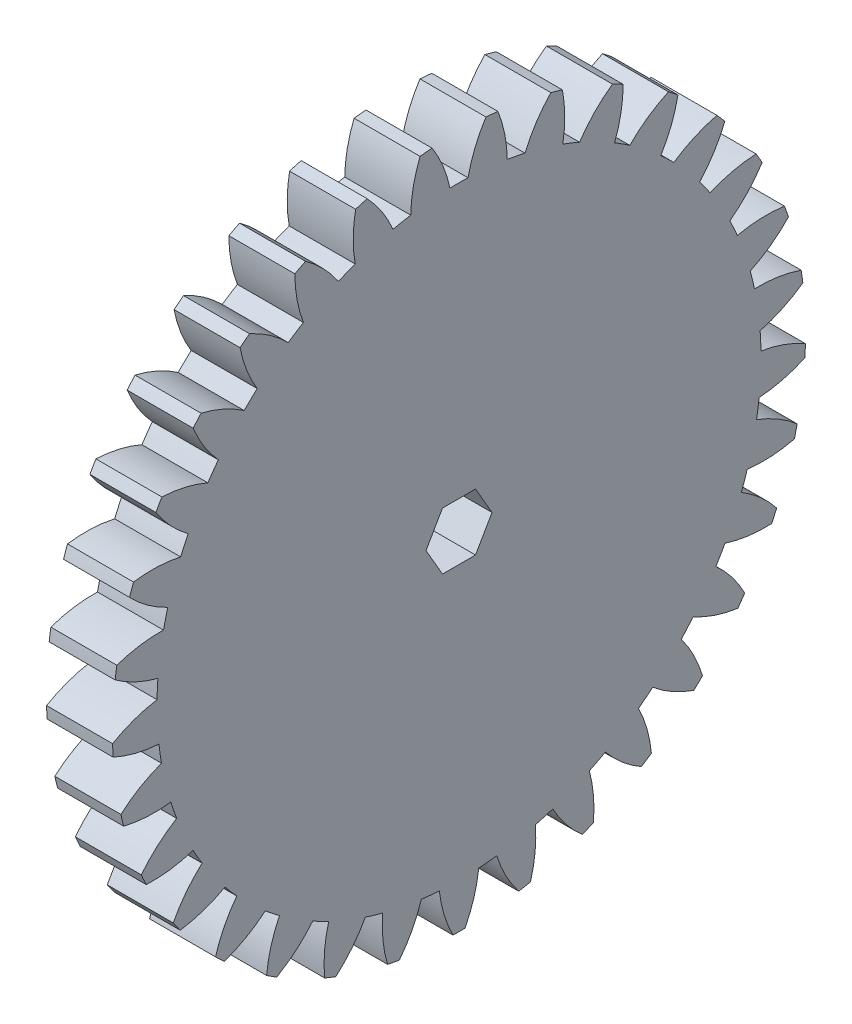
from build123d import *

# Parameters (mm, degrees)
BASPROSKE_W         = 5
BASPROSKE_H         = 26.25
TOOTHCUT_DEPTH      = 38.458310159
TEETHCUTS_COUNT     = 33
TEETHCUTS_ANGLE     = 349.090909091
BORE_DEPTH          = 50.0000508
BOSS_EXTRUDE1_DEPTH = 6


with BuildPart() as part:
    # BasProSke → Base-Revolve (revolve)
    with BuildSketch(Plane(origin=(0, 0, 0), x_dir=(1, 0, 0), z_dir=(0, 1, 0))):
        with Locations((2.5, 13.125)):
            Rectangle(BASPROSKE_W, BASPROSKE_H)
    revolve(axis=Axis((-10, 0, 0), (1, 0, 0)))

    # TooCutSke → ToothCut (cut, through all)
    with BuildSketch(Plane(origin=(0, 0, 0), x_dir=(0, 0, -1), z_dir=(1, 0, 0))):
        with BuildLine():
            ThreePointArc((0.683690741, 22.863780155), (0, 22.874), (-0.683690741, 22.863780155))
            ThreePointArc((-0.683690741, 22.863780155), (-1.217783987, 24.592276227), (-2.057504394, 26.194719331))
            ThreePointArc((-2.057504394, 26.194719331), (0, 26.2754), (2.057504394, 26.194719331))
            ThreePointArc((2.057504394, 26.194719331), (1.217783987, 24.592276227), (0.683690741, 22.863780155))
        make_face()
    toothcut = extrude(amount=TOOTHCUT_DEPTH, mode=Mode.SUBTRACT)

    # TeethCuts: ToothCut ×33 about axis
    teethcuts_axis = Axis((-10, 0, 0), (1, 0, 0))
    for i in range(1, TEETHCUTS_COUNT):
        add(toothcut.rotate(teethcuts_axis, i * TEETHCUTS_ANGLE / (TEETHCUTS_COUNT - 1)), mode=Mode.SUBTRACT)

    # BorSke → Bore (cut, symmetric)
    with BuildSketch(Plane(origin=(0, 0, 0), x_dir=(0, 0, -1), z_dir=(1, 0, 0))):
        Polygon((-2.5, 0), (-1.25, -2.165063509), (1.25, -2.165063509), (2.5, 0), (1.25, 2.165063509), (-1.25, 2.165063509), align=None)
    extrude(amount=BORE_DEPTH, both=True, mode=Mode.SUBTRACT)

    # Sketch1 → Boss-Extrude1 (add)
    with BuildSketch(Plane.ZY):
        with BuildLine():
            ThreePointArc((0.186825137, -8.998060686), (1.087459558, -7.388027892), (0.875696025, -5.555405682))
            ThreePointArc((0.875696025, -5.555405682), (1.73791157, -5.348741832), (2.556932562, -5.009138816))
            ThreePointArc((2.556932562, -5.009138816), (3.462800574, -6.616232809), (5.13778266, -7.389397069))
            ThreePointArc((5.13778266, -7.389397069), (5.290067265, -7.281152932), (5.440072088, -7.169770943))
            ThreePointArc((5.440072088, -7.169770943), (5.222347109, -5.337847421), (3.973838504, -3.979696391))
            ThreePointArc((3.973838504, -3.979696391), (4.549911569, -3.305704242), (5.012899826, -2.549551171))
            ThreePointArc((5.012899826, -2.549551171), (6.690388591, -3.317261664), (8.499932112, -2.958234922))
            ThreePointArc((8.499932112, -2.958234922), (8.559508639, -2.781152931), (8.615396399, -2.602872386))
            ThreePointArc((8.615396399, -2.602872386), (7.362475561, -1.248790656), (5.554109736, -0.883878337))
            ThreePointArc((5.554109736, -0.883878337), (5.623999991, 1.7e-08), (5.554109736, 0.883878372))
            ThreePointArc((5.554109736, 0.883878372), (7.36247556, 1.248790692), (8.615396397, 2.602872424))
            ThreePointArc((8.615396397, 2.602872424), (8.559508637, 2.781152968), (8.49993211, 2.958234959))
            ThreePointArc((8.49993211, 2.958234959), (6.690388588, 3.3172617), (5.012899824, 2.549551205))
            ThreePointArc((5.012899824, 2.549551205), (4.549911566, 3.305704276), (3.9738385, 3.979696424))
            ThreePointArc((3.9738385, 3.979696424), (5.222347104, 5.337847455), (5.440072081, 7.169770978))
            ThreePointArc((5.440072081, 7.169770978), (5.290067259, 7.281152967), (5.137782653, 7.389397103))
            ThreePointArc((5.137782653, 7.389397103), (3.462800568, 6.616232842), (2.556932557, 5.009138848))
            ThreePointArc((2.556932557, 5.009138848), (1.737911565, 5.348741863), (0.87569602, 5.555405712))
            ThreePointArc((0.87569602, 5.555405712), (1.087459551, 7.388027922), (0.186825128, 8.998060715))
            ThreePointArc((0.186825128, 8.998060715), (-1.3e-08, 9.000000015), (-0.186825154, 8.998060715))
            ThreePointArc((-0.186825154, 8.998060715), (-1.087459575, 7.388027921), (-0.875696042, 5.555405712))
            ThreePointArc((-0.875696042, 5.555405712), (-1.737911587, 5.348741861), (-2.556932579, 5.009138846))
            ThreePointArc((-2.556932579, 5.009138846), (-3.462800592, 6.616232839), (-5.137782677, 7.389397098))
            ThreePointArc((-5.137782677, 7.389397098), (-5.290067283, 7.281152962), (-5.440072105, 7.169770972))
            ThreePointArc((-5.440072105, 7.169770972), (-5.222347126, 5.33784745), (-3.973838521, 3.97969642))
            ThreePointArc((-3.973838521, 3.97969642), (-4.549911586, 3.305704271), (-5.012899843, 2.5495512))
            ThreePointArc((-5.012899843, 2.5495512), (-6.690388608, 3.317261694), (-8.499932129, 2.958234951))
            ThreePointArc((-8.499932129, 2.958234951), (-8.559508657, 2.78115296), (-8.615396416, 2.602872416))
            ThreePointArc((-8.615396416, 2.602872416), (-7.362475579, 1.248790686), (-5.554109754, 0.883878367))
            ThreePointArc((-5.554109754, 0.883878367), (-5.624000009, 1.2e-08), (-5.554109753, -0.883878343))
            ThreePointArc((-5.554109753, -0.883878343), (-7.362475577, -1.248790663), (-8.615396414, -2.602872394))
            ThreePointArc((-8.615396414, -2.602872394), (-8.559508654, -2.781152939), (-8.499932127, -2.95823493))
            ThreePointArc((-8.499932127, -2.95823493), (-6.690388605, -3.317261671), (-5.012899841, -2.549551175))
            ThreePointArc((-5.012899841, -2.549551175), (-4.549911583, -3.305704246), (-3.973838517, -3.979696394))
            ThreePointArc((-3.973838517, -3.979696394), (-5.222347121, -5.337847426), (-5.440072098, -7.169770948))
            ThreePointArc((-5.440072098, -7.169770948), (-5.290067276, -7.281152937), (-5.13778267, -7.389397073))
            ThreePointArc((-5.13778267, -7.389397073), (-3.462800585, -6.616232813), (-2.556932575, -5.009138819))
            ThreePointArc((-2.556932575, -5.009138819), (-1.737911582, -5.348741834), (-0.875696037, -5.555405683))
            ThreePointArc((-0.875696037, -5.555405683), (-1.087459568, -7.388027893), (-0.186825145, -8.998060686))
            ThreePointArc((-0.186825145, -8.998060686), (-4e-09, -8.999999985), (0.186825137, -8.998060686))
        make_face()
        Polygon((2.5, 0), (1.25, 2.165063509), (-1.25, 2.165063509), (-2.5, 0), (-1.25, -2.165063509), (1.25, -2.165063509), align=None, mode=Mode.SUBTRACT)
    extrude(amount=BOSS_EXTRUDE1_DEPTH)


solid = part.part
